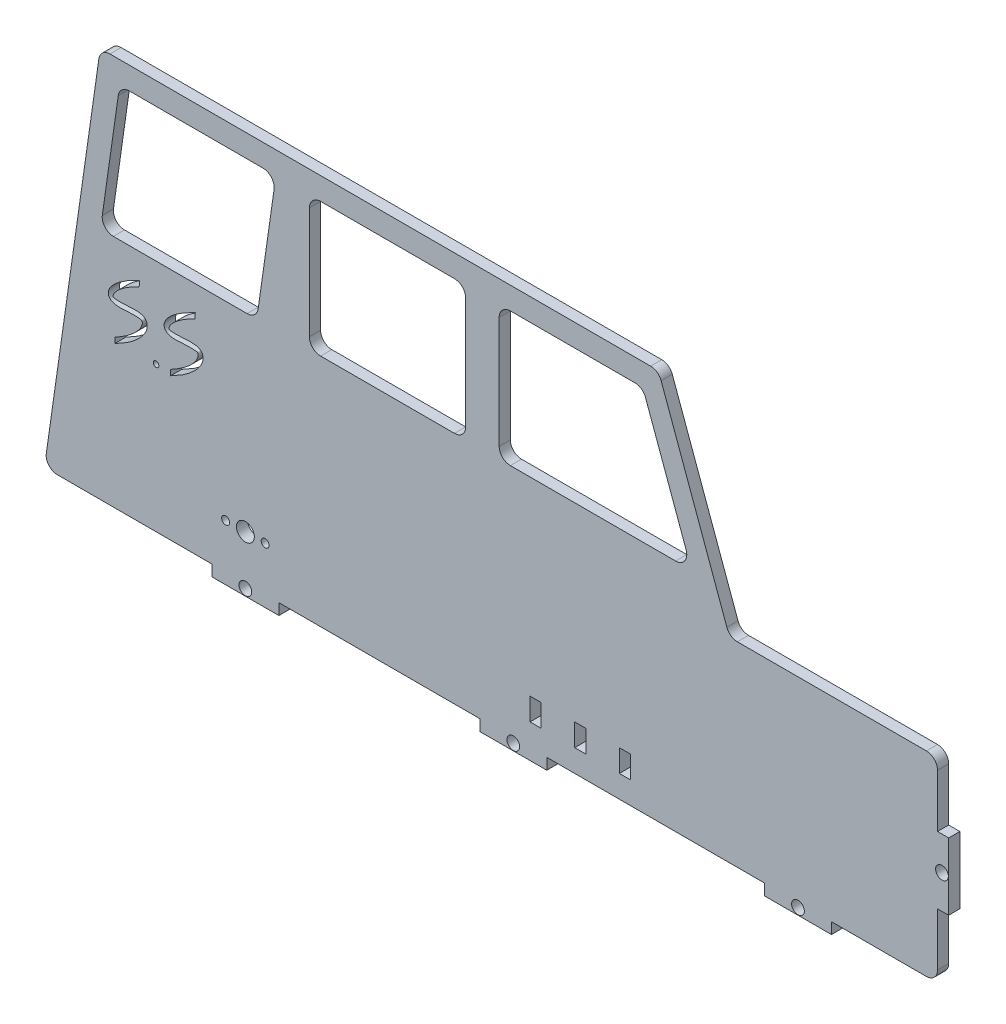
from build123d import *

# Parameters (mm, degrees)
BOSS_EXTRUDE1_DEPTH = 2.54
CUT_EXTRUDE1_REACH  = 139.823
SKETCH2_W           = 35.56
SKETCH2_H           = 30.48
FILLET1_R           = 2.54
FILLET3_R           = 2.54
CUT_EXTRUDE2_REACH  = 139.823
SKETCH4_R           = 1.4478
CUT_EXTRUDE3_REACH  = 139.823
SKETCH5_W           = 2.54
SKETCH5_H           = 5.08
LPATTERN1_COUNT     = 2
LPATTERN1_PITCH     = 12.7
CUT_EXTRUDE4_REACH  = 139.823
SKETCH8_R           = 0.635
CUT_EXTRUDE5_REACH  = 139.823
SKETCH9_R           = 2.032
SKETCH9_R_2         = 0.89916


with BuildPart() as part:
    # Sketch1 → Boss-Extrude1 (new body)
    with BuildSketch(Plane.XY):
        Polygon((-63.5, 44.45), (63.5, 44.45), (79.678476913, 0), (127, 0), (127, -14.605), (129.54, -14.605), (129.54, -29.845), (127, -29.845), (127, -44.45), (102.87, -44.45), (102.87, -46.99), (87.63, -46.99), (87.63, -44.45), (63.5, -44.45), (38.1, -44.45), (38.1, -46.99), (22.86, -46.99), (22.86, -44.45), (-22.86, -44.45), (-22.86, -46.99), (-38.1, -46.99), (-38.1, -44.45), (-63.5, -44.45), (-76.2, -44.45), align=None)
    extrude(amount=BOSS_EXTRUDE1_DEPTH)

    # Sketch2 → Cut-Extrude1 (cut, up to next)
    with BuildSketch(Plane.XY.offset(2.54), mode=Mode.PRIVATE) as cut_extrude1_sk1:
        Polygon((-59.094139359, 39.37), (-63.448425074, 8.89), (-27.888425074, 8.89), (-23.534139359, 39.37), align=None)
    cut_extrude1_tool1 = extrude(cut_extrude1_sk1.sketch, amount=-CUT_EXTRUDE1_REACH, mode=Mode.PRIVATE) & part.part
    # Sketch2 → Cut-Extrude1 (cut, up to next)
    with BuildSketch(Plane.XY.offset(2.54), mode=Mode.PRIVATE) as cut_extrude1_sk2:
        Polygon((27.265860641, 39.37), (27.265860641, 8.89), (71.036758446, 8.89), (59.942945706, 39.37), align=None)
    cut_extrude1_tool2 = extrude(cut_extrude1_sk2.sketch, amount=-CUT_EXTRUDE1_REACH, mode=Mode.PRIVATE) & part.part
    # Sketch2 → Cut-Extrude1 (cut, up to next)
    with BuildSketch(Plane.XY.offset(2.54), mode=Mode.PRIVATE) as cut_extrude1_sk3:
        with Locations((1.865860641, 24.13)):
            Rectangle(SKETCH2_W, SKETCH2_H)
    cut_extrude1_tool3 = extrude(cut_extrude1_sk3.sketch, amount=-CUT_EXTRUDE1_REACH, mode=Mode.PRIVATE) & part.part
    add(cut_extrude1_tool1.solids().sort_by_distance((-43.491282, 24.13, 2.54))[0], mode=Mode.SUBTRACT)
    add(cut_extrude1_tool2.solids().sort_by_distance((46.512014, 23.392812, 2.54))[0], mode=Mode.SUBTRACT)
    add(cut_extrude1_tool3.solids().sort_by_distance((1.865861, 24.13, 2.54))[0], mode=Mode.SUBTRACT)

    # Fillet1
    fillet1_edges = [part.edges().sort_by_distance(p)[0] for p in [
        (-59.094139359, 39.37, 1.27),
        (-23.534139359, 39.37, 1.27),
        (-27.888425074, 8.89, 1.27),
        (-63.448425074, 8.89, 1.27),
        (-15.914139359, 8.89, 1.27),
        (-15.914139359, 39.37, 1.27),
        (19.645860641, 39.37, 1.27),
        (19.645860641, 8.89, 1.27),
        (27.265860641, 39.37, 1.27),
        (59.942945706, 39.37, 1.27),
        (71.036758446, 8.89, 1.27),
        (27.265860641, 8.89, 1.27),
    ]]
    fillet(fillet1_edges, radius=FILLET1_R)

    # Fillet3
    fillet3_edges = [part.edges().sort_by_distance(p)[0] for p in [
        (-76.2, -44.45, 1.27),
        (-63.5, 44.45, 1.27),
        (63.5, 44.45, 1.27),
        (79.678476913, 0, 1.27),
        (127, 0, 1.27),
        (127, -44.45, 1.27),
    ]]
    fillet(fillet3_edges, radius=FILLET3_R)

    # Sketch4 → Cut-Extrude2 (cut, up to next)
    with BuildSketch(Plane.XY.offset(2.54), mode=Mode.PRIVATE) as cut_extrude2_sk1:
        with Locations((95.25, -45.466)):
            Circle(SKETCH4_R)
    cut_extrude2_tool1 = extrude(cut_extrude2_sk1.sketch, amount=-CUT_EXTRUDE2_REACH, mode=Mode.PRIVATE) & part.part
    # Sketch4 → Cut-Extrude2 (cut, up to next)
    with BuildSketch(Plane.XY.offset(2.54), mode=Mode.PRIVATE) as cut_extrude2_sk2:
        with Locations((30.48, -45.466)):
            Circle(SKETCH4_R)
    cut_extrude2_tool2 = extrude(cut_extrude2_sk2.sketch, amount=-CUT_EXTRUDE2_REACH, mode=Mode.PRIVATE) & part.part
    # Sketch4 → Cut-Extrude2 (cut, up to next)
    with BuildSketch(Plane.XY.offset(2.54), mode=Mode.PRIVATE) as cut_extrude2_sk3:
        with Locations((-30.48, -45.466)):
            Circle(SKETCH4_R)
    cut_extrude2_tool3 = extrude(cut_extrude2_sk3.sketch, amount=-CUT_EXTRUDE2_REACH, mode=Mode.PRIVATE) & part.part
    # Sketch4 → Cut-Extrude2 (cut, up to next)
    with BuildSketch(Plane.XY.offset(2.54), mode=Mode.PRIVATE) as cut_extrude2_sk4:
        with Locations((128.016, -22.225)):
            Circle(SKETCH4_R)
    cut_extrude2_tool4 = extrude(cut_extrude2_sk4.sketch, amount=-CUT_EXTRUDE2_REACH, mode=Mode.PRIVATE) & part.part
    add(cut_extrude2_tool1.solids().sort_by_distance((95.25, -45.466, 2.54))[0], mode=Mode.SUBTRACT)
    add(cut_extrude2_tool2.solids().sort_by_distance((30.48, -45.466, 2.54))[0], mode=Mode.SUBTRACT)
    add(cut_extrude2_tool3.solids().sort_by_distance((-30.48, -45.466, 2.54))[0], mode=Mode.SUBTRACT)
    add(cut_extrude2_tool4.solids().sort_by_distance((128.016, -22.225, 2.54))[0], mode=Mode.SUBTRACT)

    # Sketch5 → Cut-Extrude3 (cut, up to next)
    with BuildSketch(Plane.XY.offset(2.54), mode=Mode.PRIVATE) as cut_extrude3_sk1:
        with Locations((45.72, -36.83)):
            Rectangle(SKETCH5_W, SKETCH5_H)
    cut_extrude3_tool1 = extrude(cut_extrude3_sk1.sketch, amount=-CUT_EXTRUDE3_REACH, mode=Mode.PRIVATE) & part.part
    # Sketch5 → Cut-Extrude3 (cut, up to next)
    with BuildSketch(Plane.XY.offset(2.54), mode=Mode.PRIVATE) as cut_extrude3_sk2:
        with Locations((55.88, -36.83)):
            Rectangle(SKETCH5_W, SKETCH5_H)
    cut_extrude3_tool2 = extrude(cut_extrude3_sk2.sketch, amount=-CUT_EXTRUDE3_REACH, mode=Mode.PRIVATE) & part.part
    # Sketch5 → Cut-Extrude3 (cut, up to next)
    with BuildSketch(Plane.XY.offset(2.54), mode=Mode.PRIVATE) as cut_extrude3_sk3:
        with Locations((35.56, -36.83)):
            Rectangle(SKETCH5_W, SKETCH5_H)
    cut_extrude3_tool3 = extrude(cut_extrude3_sk3.sketch, amount=-CUT_EXTRUDE3_REACH, mode=Mode.PRIVATE) & part.part
    add(cut_extrude3_tool1.solids().sort_by_distance((45.72, -36.83, 2.54))[0], mode=Mode.SUBTRACT)
    add(cut_extrude3_tool2.solids().sort_by_distance((55.88, -36.83, 2.54))[0], mode=Mode.SUBTRACT)
    add(cut_extrude3_tool3.solids().sort_by_distance((35.56, -36.83, 2.54))[0], mode=Mode.SUBTRACT)

    # Cut-Sweep2: read off the stored shape, not the designer's step
    # Cut-Sweep2: loft between two sections, ruled curve by curve
    cut_sweep2_from = [
        Edge.make_bspline([(-54.642939508, 1.905854915, 6.35), (-57.304099415, 0.668518808, 6.35), (-59.416478476, -0.893450659, 6.35), (-60.42876714, -2.355663098, 6.35), (-60.546405855, -2.622560287, 6.35), (-60.587979564, -3.020566158, 6.35), (-60.502619058, -3.130752624, 6.35), (-60.305312201, -3.173901157, 6.35), (-60.214772801, -3.162040204, 6.35), (-59.832551688, -3.222540175, 6.35), (-59.534506721, -3.263699833, 6.35), (-58.54936714, -3.262562147, 6.35), (-57.741917565, -3.203008614, 6.35), (-56.065344632, -3.111210204, 6.35), (-55.193621559, -3.079346528, 6.35), (-54.094112308, -3.266370975, 6.35), (-53.763336778, -3.360347193, 6.35), (-53.182501006, -3.760755181, 6.35), (-52.955997234, -4.087730815, 6.35), (-52.774382729, -4.797642376, 6.35), (-52.799258076, -5.170020549, 6.35), (-52.99071867, -5.911343457, 6.35), (-53.158443679, -6.288478335, 6.35), (-54.349133681, -8.263349834, 6.35), (-56.451106037, -10.176189692, 6.35), (-60.198, -12.065, 6.35)], [0, 0, 0, 0, 0.258620057, 0.258620057, 0.323275072, 0.323275072, 0.387930086, 0.387930086, 0.4525851, 0.4525851, 0.517240115, 0.517240115, 0.603740201, 0.603740201, 0.690240286, 0.690240286, 0.728960251, 0.728960251, 0.767680215, 0.767680215, 0.806400179, 0.806400179, 0.845120143, 0.845120143, 1, 1, 1, 1], 3),
        Edge.make_bspline([(-54.577060492, 3.174145085, 6.35), (-57.416278589, 1.929281632, 6.35), (-59.588240206, 0.423568714, 6.35), (-61.042909081, -1.239788534, 6.35), (-61.274239292, -1.562581598, 6.35), (-61.607548881, -2.237128558, 6.35), (-61.718823809, -2.609804722, 6.35), (-61.610695609, -3.389573516, 6.35), (-61.3698856, -3.741489238, 6.35), (-60.697934691, -4.182310658, 6.35), (-60.273157078, -4.302417661, 6.35), (-59.070835151, -4.42952571, 6.35), (-58.24552255, -4.368960219, 6.35), (-56.592153916, -4.266862878, 6.35), (-55.766697475, -4.224949745, 6.35), (-54.867563055, -4.276454559, 6.35), (-54.643754327, -4.304033735, 6.35), (-54.337722779, -4.336204101, 6.35), (-54.236927565, -4.329155854, 6.35), (-54.031332602, -4.452467307, 6.35), (-53.94491355, -4.590467071, 6.35), (-53.918737423, -5.024106151, 6.35), (-53.977840555, -5.311555367, 6.35), (-54.702845259, -6.961803085, 6.35), (-56.634510429, -8.916379188, 6.35), (-60.198, -10.795, 6.35)], [0, 0, 0, 0, 0.258620057, 0.258620057, 0.323275072, 0.323275072, 0.387930086, 0.387930086, 0.4525851, 0.4525851, 0.517240115, 0.517240115, 0.603740201, 0.603740201, 0.690240286, 0.690240286, 0.728960251, 0.728960251, 0.767680215, 0.767680215, 0.806400179, 0.806400179, 0.845120143, 0.845120143, 1, 1, 1, 1], 3),
        Edge.make_line((-60.198, -10.795, 6.35), (-60.198, -12.065, 6.35)),
        Edge.make_line((-54.577060492, 3.174145085, 6.35), (-54.642939508, 1.905854915, 6.35)),
    ]
    cut_sweep2_to = [
        Edge.make_bspline([(-54.642939508, 1.905854915, -1.27), (-57.304099415, 0.668518808, -1.27), (-59.416478476, -0.893450659, -1.27), (-60.42876714, -2.355663098, -1.27), (-60.546405855, -2.622560287, -1.27), (-60.587979564, -3.020566158, -1.27), (-60.502619058, -3.130752624, -1.27), (-60.305312201, -3.173901157, -1.27), (-60.214772801, -3.162040204, -1.27), (-59.832551688, -3.222540175, -1.27), (-59.534506721, -3.263699833, -1.27), (-58.54936714, -3.262562147, -1.27), (-57.741917565, -3.203008614, -1.27), (-56.065344632, -3.111210204, -1.27), (-55.193621559, -3.079346528, -1.27), (-54.094112308, -3.266370975, -1.27), (-53.763336778, -3.360347193, -1.27), (-53.182501006, -3.760755181, -1.27), (-52.955997234, -4.087730815, -1.27), (-52.774382729, -4.797642376, -1.27), (-52.799258076, -5.170020549, -1.27), (-52.99071867, -5.911343457, -1.27), (-53.158443679, -6.288478335, -1.27), (-54.349133681, -8.263349834, -1.27), (-56.451106037, -10.176189692, -1.27), (-60.198, -12.065, -1.27)], [0, 0, 0, 0, 0.258620057, 0.258620057, 0.323275072, 0.323275072, 0.387930086, 0.387930086, 0.4525851, 0.4525851, 0.517240115, 0.517240115, 0.603740201, 0.603740201, 0.690240286, 0.690240286, 0.728960251, 0.728960251, 0.767680215, 0.767680215, 0.806400179, 0.806400179, 0.845120143, 0.845120143, 1, 1, 1, 1], 3),
        Edge.make_bspline([(-54.577060492, 3.174145085, -1.27), (-57.416278589, 1.929281632, -1.27), (-59.588240206, 0.423568714, -1.27), (-61.042909081, -1.239788534, -1.27), (-61.274239292, -1.562581598, -1.27), (-61.607548881, -2.237128558, -1.27), (-61.718823809, -2.609804722, -1.27), (-61.610695609, -3.389573516, -1.27), (-61.3698856, -3.741489238, -1.27), (-60.697934691, -4.182310658, -1.27), (-60.273157078, -4.302417661, -1.27), (-59.070835151, -4.42952571, -1.27), (-58.24552255, -4.368960219, -1.27), (-56.592153916, -4.266862878, -1.27), (-55.766697475, -4.224949745, -1.27), (-54.867563055, -4.276454559, -1.27), (-54.643754327, -4.304033735, -1.27), (-54.337722779, -4.336204101, -1.27), (-54.236927565, -4.329155854, -1.27), (-54.031332602, -4.452467307, -1.27), (-53.94491355, -4.590467071, -1.27), (-53.918737423, -5.024106151, -1.27), (-53.977840555, -5.311555367, -1.27), (-54.702845259, -6.961803085, -1.27), (-56.634510429, -8.916379188, -1.27), (-60.198, -10.795, -1.27)], [0, 0, 0, 0, 0.258620057, 0.258620057, 0.323275072, 0.323275072, 0.387930086, 0.387930086, 0.4525851, 0.4525851, 0.517240115, 0.517240115, 0.603740201, 0.603740201, 0.690240286, 0.690240286, 0.728960251, 0.728960251, 0.767680215, 0.767680215, 0.806400179, 0.806400179, 0.845120143, 0.845120143, 1, 1, 1, 1], 3),
        Edge.make_line((-60.198, -10.795, -1.27), (-60.198, -12.065, -1.27)),
        Edge.make_line((-54.577060492, 3.174145085, -1.27), (-54.642939508, 1.905854915, -1.27)),
    ]
    cut_sweep2 = Solid(Shell([*[Face.make_surface_from_curves(cut_sweep2_from[k], cut_sweep2_to[k]) for k in range(4)], Face(Wire(cut_sweep2_from)), Face(Wire(cut_sweep2_to))]))
    add(cut_sweep2, mode=Mode.SUBTRACT)

    # LPattern1: Cut-Sweep2 ×2
    with Locations(*[(i * LPATTERN1_PITCH, 0, 0) for i in range(1, LPATTERN1_COUNT)]):
        add(cut_sweep2, mode=Mode.SUBTRACT)

    # Sketch8 → Cut-Extrude4 (cut, up to next)
    with BuildSketch(Plane.XY.offset(2.54), mode=Mode.PRIVATE) as cut_extrude4_sk1:
        with Locations((-50.8, -11.43)):
            Circle(SKETCH8_R)
    cut_extrude4_tool1 = extrude(cut_extrude4_sk1.sketch, amount=-CUT_EXTRUDE4_REACH, mode=Mode.PRIVATE) & part.part
    add(cut_extrude4_tool1.solids().sort_by_distance((-50.8, -11.43, 2.54))[0], mode=Mode.SUBTRACT)

    # Sketch9 → Cut-Extrude5 (cut, up to next)
    with BuildSketch(Plane.XY.offset(2.54), mode=Mode.PRIVATE) as cut_extrude5_sk1:
        with Locations((-30.48, -34.29)):
            Circle(SKETCH9_R)
    cut_extrude5_tool1 = extrude(cut_extrude5_sk1.sketch, amount=-CUT_EXTRUDE5_REACH, mode=Mode.PRIVATE) & part.part
    # Sketch9 → Cut-Extrude5 (cut, up to next)
    with BuildSketch(Plane.XY.offset(2.54), mode=Mode.PRIVATE) as cut_extrude5_sk2:
        with Locations((-25.9842, -34.29)):
            Circle(SKETCH9_R_2)
    cut_extrude5_tool2 = extrude(cut_extrude5_sk2.sketch, amount=-CUT_EXTRUDE5_REACH, mode=Mode.PRIVATE) & part.part
    # Sketch9 → Cut-Extrude5 (cut, up to next)
    with BuildSketch(Plane.XY.offset(2.54), mode=Mode.PRIVATE) as cut_extrude5_sk3:
        with Locations((-34.9758, -34.29)):
            Circle(SKETCH9_R_2)
    cut_extrude5_tool3 = extrude(cut_extrude5_sk3.sketch, amount=-CUT_EXTRUDE5_REACH, mode=Mode.PRIVATE) & part.part
    add(cut_extrude5_tool1.solids().sort_by_distance((-30.48, -34.29, 2.54))[0], mode=Mode.SUBTRACT)
    add(cut_extrude5_tool2.solids().sort_by_distance((-25.9842, -34.29, 2.54))[0], mode=Mode.SUBTRACT)
    add(cut_extrude5_tool3.solids().sort_by_distance((-34.9758, -34.29, 2.54))[0], mode=Mode.SUBTRACT)


solid = part.part
